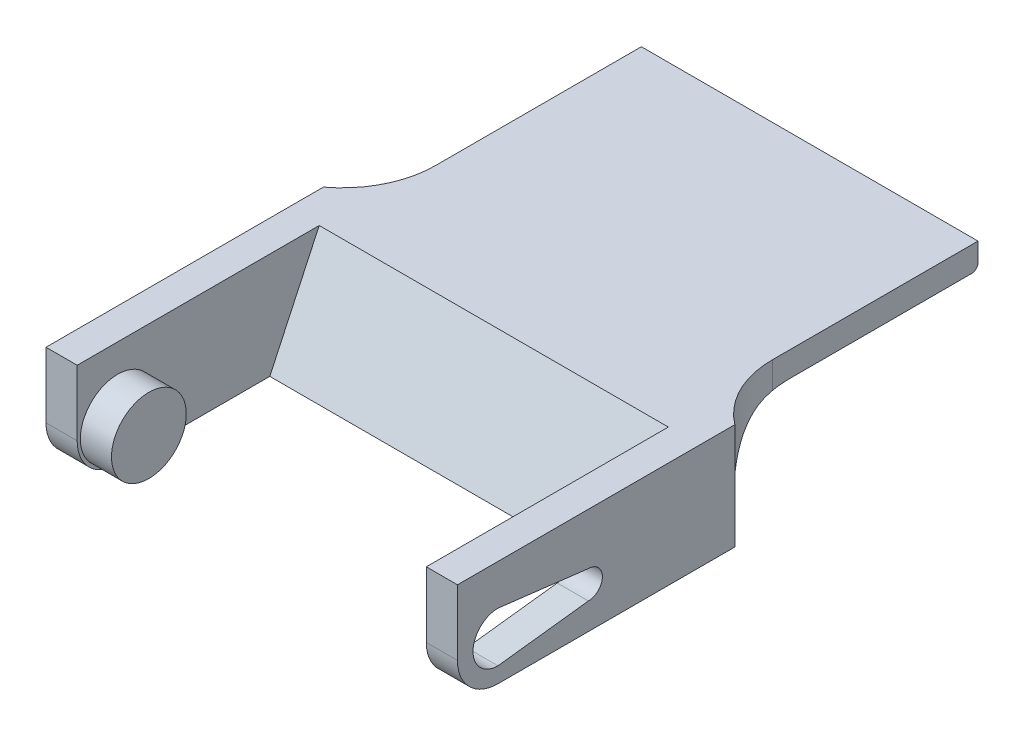
from build123d import *

# Parameters (mm, degrees)
SKETCH1_W                = 54
SKETCH1_H                = 60
BOSS_EXTRUDE1_DEPTH      = 4
BOSS_EXTRUDE2_DEPTH      = 6
BOSS_EXTRUDE2_DEPTH_BACK = 60
SKETCH2_W                = 10
SKETCH2_H                = 17
SKETCH3_W                = 28
SKETCH3_H                = 13
BOSS_EXTRUDE3_DEPTH      = 66
SKETCH9_W                = 56
SKETCH9_H                = 28
CUT_EXTRUDE3_DEPTH       = 13
SKETCH10_W               = 5
SKETCH10_H               = 28
BOSS_EXTRUDE6_DEPTH      = 4
SKETCH11_R               = 2.25
CUT_EXTRUDE5_DEPTH       = 91.138781887
SKETCH12_W               = 5
SKETCH12_H               = 17
BOSS_EXTRUDE7_DEPTH      = 4
CUT_EXTRUDE6_DEPTH       = 91.138781887
FILLET3_R                = 1
BOSS_EXTRUDE8_DEPTH      = 10
BOSS_EXTRUDE8_DEPTH_BACK = 5
SKETCH14_R               = 4
SKETCH15_W               = 17
SKETCH15_H               = 8
BOSS_EXTRUDE9_DEPTH      = 5
SKETCH16_R               = 6
BOSS_EXTRUDE11_DEPTH     = 12
SKETCH17_R               = 6
CUT_EXTRUDE7_DEPTH       = 5
CHAMFER1_SIZE            = 9.326153163
CHAMFER1_SIZE_2          = 20
SKETCH18_W               = 66
SKETCH18_H               = 5
BOSS_EXTRUDE14_DEPTH     = 17
FILLET8_R                = 15
FILLET9_R                = 15


with BuildPart() as part:
    # Sketch1 → Boss-Extrude1 (new body)
    with BuildSketch(Plane(origin=(0, 0, 0), x_dir=(1, 0, 0), z_dir=(0, 1, 0))):
        with Locations((27, 30)):
            Rectangle(SKETCH1_W, SKETCH1_H)
    extrude(amount=BOSS_EXTRUDE1_DEPTH)

    # Sketch2 → Boss-Extrude2 (add, two sides: drawn at the far end of the back side and taken through both)
    with BuildSketch(Plane(origin=(54, 0, 0), x_dir=(0, 0, -1), z_dir=(1, 0, 0)).offset(-BOSS_EXTRUDE2_DEPTH_BACK)):
        with Locations((5, -4.5)):
            Rectangle(SKETCH2_W, SKETCH2_H)
    extrude(amount=BOSS_EXTRUDE2_DEPTH + BOSS_EXTRUDE2_DEPTH_BACK)

    # Sketch3 → Boss-Extrude3 (add, through all)
    with BuildSketch(Plane(origin=(60, 0, 0), x_dir=(0, 0, -1), z_dir=(1, 0, 0))):
        with Locations((-14, -6.5)):
            Rectangle(SKETCH3_W, SKETCH3_H)
    extrude(amount=-BOSS_EXTRUDE3_DEPTH)

    # Sketch9 → Cut-Extrude3 (cut)
    with BuildSketch(Plane(origin=(0, 0, 0), x_dir=(1, 0, 0), z_dir=(0, 1, 0))):
        with Locations((27, -14)):
            Rectangle(SKETCH9_W, SKETCH9_H)
    extrude(amount=-CUT_EXTRUDE3_DEPTH, mode=Mode.SUBTRACT)

    # Sketch10 → Boss-Extrude6 (add)
    with BuildSketch(Plane(origin=(0, 0, 0), x_dir=(1, 0, 0), z_dir=(0, 1, 0))):
        with Locations((-3.5, -14)):
            Rectangle(SKETCH10_W, SKETCH10_H)
        with Locations((57.5, -14)):
            Rectangle(SKETCH10_W, SKETCH10_H)
    extrude(amount=BOSS_EXTRUDE6_DEPTH)

    # Sketch11 → Cut-Extrude5 (cut, through all)
    with BuildSketch(Plane(origin=(60, 0, 0), x_dir=(0, 0, -1), z_dir=(1, 0, 0))):
        with BuildLine():
            Line((-22.048344565, -2.614854966), (-23, -2.5))
            ThreePointArc((-23, -2.5), (-27, -6.5), (-23, -10.5))
            Line((-23, -10.5), (-22.048344565, -10.385145034))
            ThreePointArc((-22.048344565, -10.385145034), (-19.853047368, -8.96914745), (-19, -6.5))
            ThreePointArc((-19, -6.5), (-19.853047368, -4.03085255), (-22.048344565, -2.614854966))
        make_face()
        with BuildLine():
            Line((-8.5, -4.25), (-22.048344565, -2.614854966))
            ThreePointArc((-22.048344565, -2.614854966), (-19.853047368, -4.03085255), (-19, -6.5))
            ThreePointArc((-19, -6.5), (-19.853047368, -8.96914745), (-22.048344565, -10.385145034))
            Line((-22.048344565, -10.385145034), (-8.5, -8.75))
            ThreePointArc((-8.5, -8.75), (-10.75, -6.5), (-8.5, -4.25))
        make_face()
        with Locations((-8.5, -6.5)):
            Circle(SKETCH11_R)
    extrude(amount=-CUT_EXTRUDE5_DEPTH, mode=Mode.SUBTRACT)

    # Sketch12 → Boss-Extrude7 (add)
    with BuildSketch(Plane.XY.offset(28)):
        with Locations((57.5, -4.5)):
            Rectangle(SKETCH12_W, SKETCH12_H)
        with Locations((-3.5, -4.5)):
            Rectangle(SKETCH12_W, SKETCH12_H)
    extrude(amount=BOSS_EXTRUDE7_DEPTH)

    # Sketch13 → Cut-Extrude6 (cut, through all)
    with BuildSketch(Plane.ZY.offset(6)):
        with BuildLine():
            Line((29.5, -6.5), (29.5, 4))
            Line((29.5, 4), (32, 4))
            Line((32, 4), (32, -13))
            Line((32, -13), (23, -13))
            ThreePointArc((23, -13), (27.596194078, -11.096194078), (29.5, -6.5))
        make_face()
    extrude(amount=-CUT_EXTRUDE6_DEPTH, mode=Mode.SUBTRACT)

    # Fillet3
    fillet3_edges = [part.edges().sort_by_distance(p)[0] for p in [
        (27, 0, -60),
    ]]
    fillet(fillet3_edges, radius=FILLET3_R)

    # Sketch14 → Boss-Extrude8 (add, two sides: drawn at the far end of the back side and taken through both)
    with BuildSketch(Plane(origin=(-1, 0, 0), x_dir=(0, 0, -1), z_dir=(1, 0, 0)).offset(-BOSS_EXTRUDE8_DEPTH_BACK)):
        with Locations((-23, -6.5)):
            Circle(SKETCH14_R)
    extrude(amount=BOSS_EXTRUDE8_DEPTH + BOSS_EXTRUDE8_DEPTH_BACK)

    # Sketch15 → Boss-Extrude9 (add)
    with BuildSketch(Plane(origin=(-1, 0, 0), x_dir=(0, 0, -1), z_dir=(1, 0, 0))):
        with Locations((-14.5, -6.5)):
            Rectangle(SKETCH15_W, SKETCH15_H)
    extrude(amount=-BOSS_EXTRUDE9_DEPTH)

    # Sketch16 → Boss-Extrude11 (add)
    with BuildSketch(Plane(origin=(9, 0, 0), x_dir=(0, 0, -1), z_dir=(1, 0, 0))):
        with Locations((-23, -6.5)):
            Circle(SKETCH16_R)
    extrude(amount=-BOSS_EXTRUDE11_DEPTH)

    # Sketch17 → Cut-Extrude7 (cut)
    with BuildSketch(Plane(origin=(9, 0, 0), x_dir=(0, 0, -1), z_dir=(1, 0, 0))):
        with Locations((-23, -6.5)):
            Circle(SKETCH17_R)
    extrude(amount=-CUT_EXTRUDE7_DEPTH, mode=Mode.SUBTRACT)

    # Chamfer1
    # the kernel refuses this chamfer: 20, 9.326153163 mm, written as the material it takes off along each edge
    with BuildSketch(Plane(origin=(55, 4, 0), x_dir=(0, 0.07481330637059955, -0.9971975577536774), z_dir=(-1, 0, 0))) as chamfer1_piece_1:
        Polygon((CHAMFER1_SIZE * 0.997197557764, CHAMFER1_SIZE * 0.0748133063714), (-CHAMFER1_SIZE_2 * 0.0748133063706, CHAMFER1_SIZE_2 * 0.997197557754), (0, 0), align=None)
    extrude(amount=56, mode=Mode.SUBTRACT)

    # Sketch18 → Boss-Extrude14 (add)
    with BuildSketch(Plane(origin=(0, 4, 0), x_dir=(1, 0, 0), z_dir=(0, 1, 0))):
        with Locations((27, 12.5)):
            Rectangle(SKETCH18_W, SKETCH18_H)
    extrude(amount=-BOSS_EXTRUDE14_DEPTH)

    # Fillet8
    # the kernel refuses this fillet: 15 mm, written as the material it adds along each edge
    with BuildSketch(Plane(origin=(54, 0, -15), x_dir=(0, -1, 0), z_dir=(-1, 0, 0))) as fillet8_piece_1:
        with BuildLine():
            CenterArc((15, -14.866068747), FILLET8_R, 97.662255661, 82.337744339)
            Line((0, -14.866068747), (-0.3, -14.866068747))
            Line((-0.3, -14.866068747), (-0.3, 0))
            Line((-0.3, 0), (0, 0.3))
            ThreePointArc((0, 0.3), (6.5, 0.3), (12.96, 0.297321375))
            Line((12.96, 0.297321375), (13, 0))
        make_face()
    extrude(amount=54)

    # Fillet9
    # the kernel refuses this fillet: 15 mm, written as the material it adds along each edge
    with BuildSketch(Plane(origin=(54, 4, -15), x_dir=(1, 0, 0), z_dir=(0, -1, 0))) as fillet9_piece_1_section:
        with BuildLine():
            CenterArc((15, -12), FILLET9_R, 126.869897646, 53.130102354)
            Line((0, -12), (0, 0))
            Line((0, 0), (6, 0))
        make_face()
    fillet9_piece_1 = extrude(amount=17, mode=Mode.PRIVATE)
    fillet9_piece_1 = fillet9_piece_1 - Plane(origin=(58.238574597, -15, -29.866068747), x_dir=(0, -1, 0), z_dir=(1, 0, 0)) * Cylinder(15, 83, mode=Mode.PRIVATE)
    add(fillet9_piece_1)
    with BuildSketch(Plane(origin=(0, -13, -15), x_dir=(0, 0, -1), z_dir=(0, 1, 0))) as fillet9_piece_2_section:
        with BuildLine():
            CenterArc((12, 15), FILLET9_R, 216.869897646, 53.130102354)
            Line((0, 6), (0, 0))
            Line((0, 0), (12, 0))
        make_face()
    fillet9_piece_2 = extrude(amount=17, mode=Mode.PRIVATE)
    fillet9_piece_2 = fillet9_piece_2 - Plane(origin=(-0.149142202, -15, -29.866068747), x_dir=(0, -1, 0), z_dir=(1, 0, 0)) * Cylinder(15, 82, mode=Mode.PRIVATE)
    add(fillet9_piece_2)


solid = part.part
